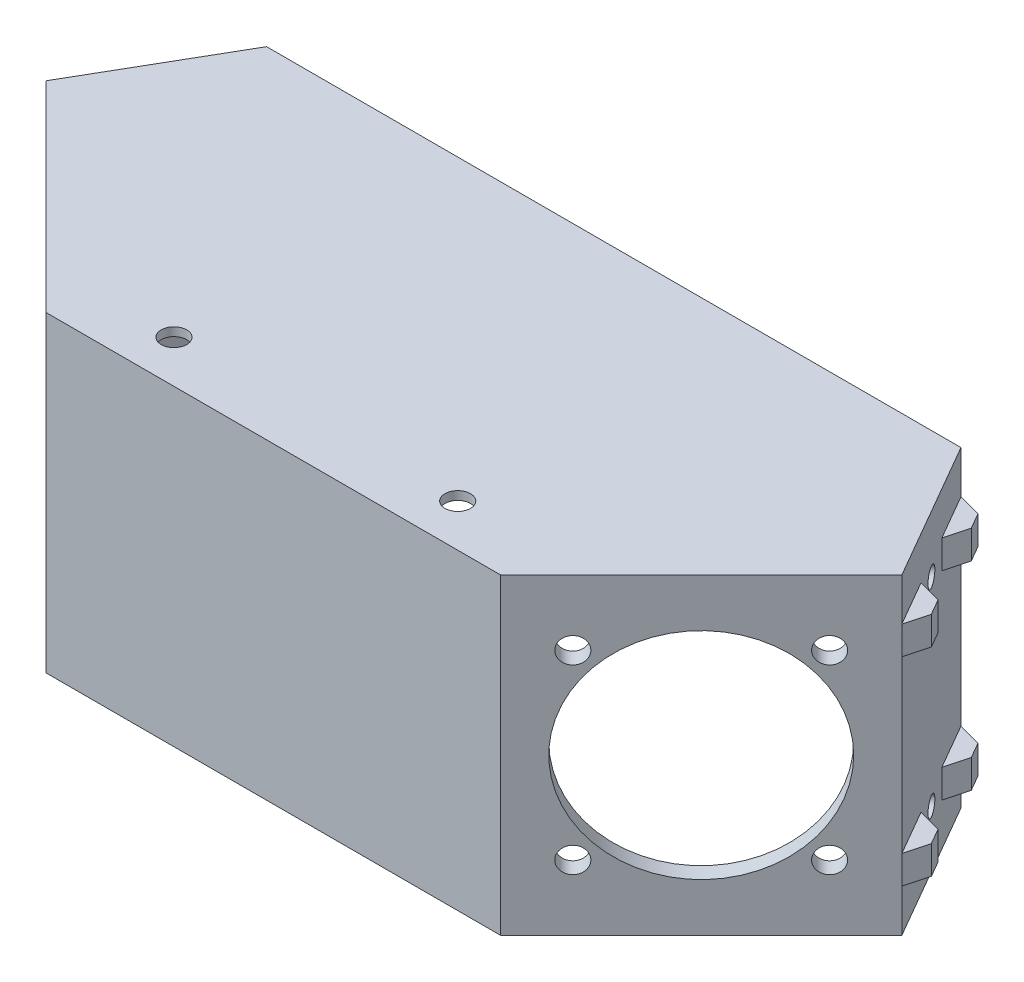
from build123d import *

# Parameters (mm, degrees)
BOSS_EXTRUDE1_DEPTH      = 55
SHELL1_T                 = -3
CUT_EXTRUDE1_REACH       = 167.077
SKETCH2_R                = 19
SKETCH2_R_2              = 2.25
CUT_EXTRUDE2_REACH       = 170.904
SKETCH3_R                = 1.65
SKETCH4_W                = 9.228601628
SKETCH4_H                = 5
BOSS_EXTRUDE2_DEPTH      = 3
CHAMFER1_SIZE            = 3
CHAMFER1_OF_MIRROR2_SIZE = 3
SKETCH5_R                = 2.25
CUT_EXTRUDE3_DEPTH       = 147.36190521
CUT_EXTRUDE4_DEPTH       = 1.5


with BuildPart() as part:
    # Sketch1 → Boss-Extrude1 (new body)
    with BuildSketch(Plane(origin=(0, 0, 0), x_dir=(1, 0, 0), z_dir=(0, 1, 0))):
        Polygon((40.050177105, -112), (-40.050177105, -112), (-75.405516164, -76.644660941), (-61.176914536, -52), (61.176914536, -52), (75.405516164, -76.644660941), align=None)
    extrude(amount=BOSS_EXTRUDE1_DEPTH)

    # Shell1
    shell1_openings = [part.faces().sort_by_distance(p)[0] for p in [
        (0, 27.5, 52),
        (0, 0, 79.968655268),
    ]]
    offset(amount=SHELL1_T, openings=shell1_openings, kind=Kind.INTERSECTION)

    # Sketch2 → Cut-Extrude1 (cut, up to next)
    with BuildSketch(Plane(origin=(76.025088553, 0, 76.025088553), x_dir=(0.7071067811865462, 0, -0.7071067811865488), z_dir=(0.7071067811865488, 0, 0.7071067811865462)), mode=Mode.PRIVATE) as cut_extrude1_sk1:
        with Locations((-25.876207674, 27.5)):
            Circle(SKETCH2_R)
    cut_extrude1_tool1 = extrude(cut_extrude1_sk1.sketch, amount=-CUT_EXTRUDE1_REACH, mode=Mode.PRIVATE) & part.part
    # Sketch2 → Cut-Extrude1 (cut, up to next)
    with BuildSketch(Plane(origin=(76.025088553, 0, 76.025088553), x_dir=(0.7071067811865462, 0, -0.7071067811865488), z_dir=(0.7071067811865488, 0, 0.7071067811865462)), mode=Mode.PRIVATE) as cut_extrude1_sk2:
        with Locations((-41.876207674, 11.5)):
            Circle(SKETCH2_R_2)
    cut_extrude1_tool2 = extrude(cut_extrude1_sk2.sketch, amount=-CUT_EXTRUDE1_REACH, mode=Mode.PRIVATE) & part.part
    # Sketch2 → Cut-Extrude1 (cut, up to next)
    with BuildSketch(Plane(origin=(76.025088553, 0, 76.025088553), x_dir=(0.7071067811865462, 0, -0.7071067811865488), z_dir=(0.7071067811865488, 0, 0.7071067811865462)), mode=Mode.PRIVATE) as cut_extrude1_sk3:
        with Locations((-9.876207674, 11.5)):
            Circle(SKETCH2_R_2)
    cut_extrude1_tool3 = extrude(cut_extrude1_sk3.sketch, amount=-CUT_EXTRUDE1_REACH, mode=Mode.PRIVATE) & part.part
    # Sketch2 → Cut-Extrude1 (cut, up to next)
    with BuildSketch(Plane(origin=(76.025088553, 0, 76.025088553), x_dir=(0.7071067811865462, 0, -0.7071067811865488), z_dir=(0.7071067811865488, 0, 0.7071067811865462)), mode=Mode.PRIVATE) as cut_extrude1_sk4:
        with Locations((-9.876207674, 43.5)):
            Circle(SKETCH2_R_2)
    cut_extrude1_tool4 = extrude(cut_extrude1_sk4.sketch, amount=-CUT_EXTRUDE1_REACH, mode=Mode.PRIVATE) & part.part
    # Sketch2 → Cut-Extrude1 (cut, up to next)
    with BuildSketch(Plane(origin=(76.025088553, 0, 76.025088553), x_dir=(0.7071067811865462, 0, -0.7071067811865488), z_dir=(0.7071067811865488, 0, 0.7071067811865462)), mode=Mode.PRIVATE) as cut_extrude1_sk5:
        with Locations((-41.876207674, 43.5)):
            Circle(SKETCH2_R_2)
    cut_extrude1_tool5 = extrude(cut_extrude1_sk5.sketch, amount=-CUT_EXTRUDE1_REACH, mode=Mode.PRIVATE) & part.part
    cut_extrude1_1 = cut_extrude1_tool1.solids().sort_by_distance((57.727847, 27.5, 94.32233))[0]
    add(cut_extrude1_1, mode=Mode.SUBTRACT)
    cut_extrude1_2 = cut_extrude1_tool2.solids().sort_by_distance((46.414138, 11.5, 105.636039))[0]
    add(cut_extrude1_2, mode=Mode.SUBTRACT)
    cut_extrude1_3 = cut_extrude1_tool3.solids().sort_by_distance((69.041555, 11.5, 83.008622))[0]
    add(cut_extrude1_3, mode=Mode.SUBTRACT)
    cut_extrude1_4 = cut_extrude1_tool4.solids().sort_by_distance((69.041555, 43.5, 83.008622))[0]
    add(cut_extrude1_4, mode=Mode.SUBTRACT)
    cut_extrude1_5 = cut_extrude1_tool5.solids().sort_by_distance((46.414138, 43.5, 105.636039))[0]
    add(cut_extrude1_5, mode=Mode.SUBTRACT)
    cut_extrude1 = cut_extrude1_1 + cut_extrude1_2 + cut_extrude1_3 + cut_extrude1_4 + cut_extrude1_5  # Cut-Extrude1 as one shape, for the pattern or mirror that repeats it

    # Sketch3 → Cut-Extrude2 (cut, up to next)
    with BuildSketch(Plane(origin=(23.366025404, 0, -13.490381057), x_dir=(-0.5000000000000074, 0, -0.8660254037844345), z_dir=(0.8660254037844344, 0, -0.5000000000000073)), mode=Mode.PRIVATE) as cut_extrude2_sk1:
        with Locations((-89.850379893, 10)):
            Circle(SKETCH3_R)
    cut_extrude2_tool1 = extrude(cut_extrude2_sk1.sketch, amount=-CUT_EXTRUDE2_REACH, mode=Mode.PRIVATE) & part.part
    # Sketch3 → Cut-Extrude2 (cut, up to next)
    with BuildSketch(Plane(origin=(23.366025404, 0, -13.490381057), x_dir=(-0.5000000000000074, 0, -0.8660254037844345), z_dir=(0.8660254037844344, 0, -0.5000000000000073)), mode=Mode.PRIVATE) as cut_extrude2_sk2:
        with Locations((-89.850379893, 45)):
            Circle(SKETCH3_R)
    cut_extrude2_tool2 = extrude(cut_extrude2_sk2.sketch, amount=-CUT_EXTRUDE2_REACH, mode=Mode.PRIVATE) & part.part
    cut_extrude2_1 = cut_extrude2_tool1.solids().sort_by_distance((68.291215, 10, 64.32233))[0]
    add(cut_extrude2_1, mode=Mode.SUBTRACT)
    cut_extrude2_2 = cut_extrude2_tool2.solids().sort_by_distance((68.291215, 45, 64.32233))[0]
    add(cut_extrude2_2, mode=Mode.SUBTRACT)
    cut_extrude2 = cut_extrude2_1 + cut_extrude2_2  # Cut-Extrude2 as one shape, for the pattern or mirror that repeats it

    # Sketch4 → Boss-Extrude2 (add)
    with BuildSketch(Plane(origin=(23.366025404, 0, -13.490381057), x_dir=(-0.5000000000000074, 0, -0.8660254037844345), z_dir=(0.8660254037844344, 0, -0.5000000000000073))):
        with Locations((-80.236079079, 10)):
            Rectangle(SKETCH4_W, SKETCH4_H)
        with Locations((-99.464680707, 10)):
            Rectangle(SKETCH4_W, SKETCH4_H)
        with Locations((-80.236079079, 45)):
            Rectangle(SKETCH4_W, SKETCH4_H)
        with Locations((-99.464680707, 45)):
            Rectangle(SKETCH4_W, SKETCH4_H)
    boss_extrude2 = extrude(amount=BOSS_EXTRUDE2_DEPTH)

    # Chamfer1
    chamfer1_edges = [part.edges().sort_by_distance(p)[0] for p in [
        (63.774990748, 10, 50.5),
        (63.774990748, 45, 50.5),
        (68.389291562, 45, 58.492203451),
        (68.389291562, 10, 58.492203451),
        (73.389291562, 10, 67.152457489),
        (73.389291562, 45, 67.152457489),
        (78.003592376, 10, 75.144660941),
        (78.003592376, 45, 75.144660941),
    ]]
    chamfer(chamfer1_edges, length=CHAMFER1_SIZE - 0.0001)  # a hair under: the kernel refuses the full size

    # Mirror2: Cut-Extrude1, Cut-Extrude2, Boss-Extrude2 across plane
    add(cut_extrude1.mirror(Plane(origin=(0, 0, 0), x_dir=(0, 0, 1), z_dir=(1, 0, 0))), mode=Mode.SUBTRACT)
    add(cut_extrude2.mirror(Plane(origin=(0, 0, 0), x_dir=(0, 0, 1), z_dir=(1, 0, 0))), mode=Mode.SUBTRACT)
    add(boss_extrude2.mirror(Plane(origin=(0, 0, 0), x_dir=(0, 0, 1), z_dir=(1, 0, 0))))

    # Chamfer1 of Mirror2
    chamfer1_of_mirror2_edges = [part.edges().sort_by_distance(p)[0] for p in [
        (-63.774990748, 10, 50.5),
        (-63.774990748, 45, 50.5),
        (-68.389291562, 45, 58.492203451),
        (-68.389291562, 10, 58.492203451),
        (-73.389291562, 10, 67.152457489),
        (-73.389291562, 45, 67.152457489),
        (-78.003592376, 10, 75.144660941),
        (-78.003592376, 45, 75.144660941),
    ]]
    chamfer(chamfer1_of_mirror2_edges, length=CHAMFER1_OF_MIRROR2_SIZE - 0.0001)  # a hair under: the kernel refuses the full size

    # Sketch5 → Cut-Extrude3 (cut, through all)
    with BuildSketch(Plane(origin=(0, 55, 0), x_dir=(1, 0, 0), z_dir=(0, 1, 0))):
        with Locations(Location((-25, -104.5, 0), (0, 0, 270))):
            Circle(SKETCH5_R)
        with Locations(Location((25, -104.5, 0), (0, 0, 270))):
            Circle(SKETCH5_R)
    extrude(amount=-CUT_EXTRUDE3_DEPTH, mode=Mode.SUBTRACT)

    # Sketch6 → Cut-Extrude4 (cut)
    with BuildSketch(Plane.XZ.offset(-52)):
        Polygon((-57.712812921, 52), (57.712812921, 52), (71.656449471, 76.151086947), (38.807536418, 109), (-38.807536418, 109), (-71.656449471, 76.151086947), align=None)
    extrude(amount=-CUT_EXTRUDE4_DEPTH, mode=Mode.SUBTRACT)


solid = part.part
